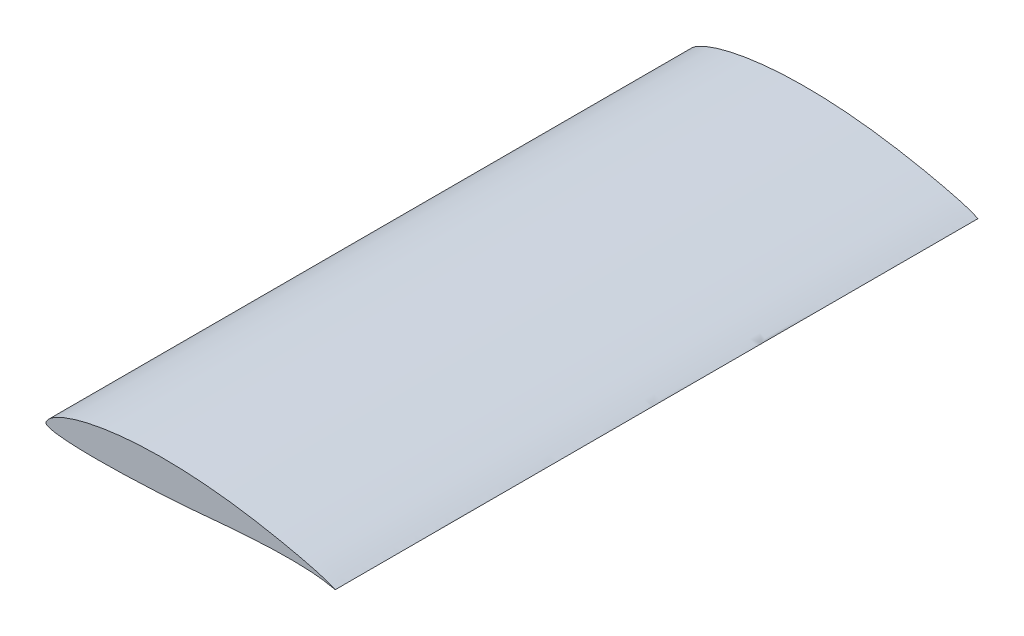
from build123d import *

# Parameters (mm, degrees)
BOSS_EXTRUDE1_DEPTH = 300


with BuildPart() as part:
    # Sketch1 → Boss-Extrude1 (new body)
    with BuildSketch(Plane.XY):
        with BuildLine():
            add(Edge.make_bspline(
                [(135, 0), (134.998856175, 0.011734331), (134.11877247, 0.333260919), (133.283583629, 0.733394832), (131.337782617, 1.50770618), (128.956602453, 2.286209997), (125.866023455, 3.16625559), (122.205613646, 4.118787736), (117.978812118, 5.136407228), (113.257079491, 6.194669425), (108.096676621, 7.270430983), (102.565667338, 8.338772342), (96.728352206, 9.3648848), (90.648870786, 10.316223784), (84.383887966, 11.155832684), (77.987641485, 11.853962041), (71.517637108, 12.402428106), (65.030841845, 12.79009708), (58.586715824, 13.000143501), (52.241828091, 13.028798077), (46.052187751, 12.876573765), (40.0697387, 12.537117596), (34.345018554, 12.019037133), (28.925444072, 11.334956535), (23.857171858, 10.506249331), (19.186584425, 9.54360867), (14.954211961, 8.477878883), (11.199486708, 7.322199999), (7.95395167, 6.10794757), (5.24216305, 4.860081916), (3.088507852, 3.610430378), (1.480582104, 2.370600711), (0.48831342, 1.213057815), (0.011852242, 0.395357712), (-0.008102004, -0.234860735), (0.400130368, -0.918035484), (1.746070552, -1.314768856), (3.653985826, -1.831338245), (6.328297823, -2.199558717), (9.659694307, -2.516444712), (13.645253431, -2.734899101), (18.231084992, -2.869337382), (23.370720618, -2.920002627), (29.005229526, -2.885079851), (35.071675286, -2.76841477), (41.503572026, -2.57040615), (48.231425582, -2.282953366), (55.186991831, -1.913504914), (62.308327518, -1.446499283), (69.549730117, -0.86817279), (76.867395967, -0.200406461), (84.204866877, 0.446142467), (91.466951805, 1.020717536), (98.53908503, 1.479607517), (105.302188706, 1.789518517), (111.633357938, 1.937188067), (117.420269605, 1.909305385), (122.523865845, 1.726646553), (126.889290121, 1.38143247), (130.220327227, 0.971114814), (132.890727166, 0.464937428), (133.96647544, 0.266874605), (135.001208219, -0.012394936), (135, 0)],
                knots=[0, 0, 0, 0, 0.001693524, 0.006395447, 0.013461651, 0.022753575, 0.034367307, 0.048191023, 0.064031392, 0.081680617, 0.100894124, 0.121431794, 0.143025453, 0.165434011, 0.188439039, 0.211855124, 0.235496289, 0.259143745, 0.282614908, 0.305701545, 0.328231584, 0.350030434, 0.370943883, 0.390816529, 0.409505873, 0.42685655, 0.442733385, 0.457018388, 0.46961507, 0.480449695, 0.48947186, 0.496730301, 0.502329147, 0.50625566, 0.506441945, 0.509181516, 0.513913846, 0.521178419, 0.530944157, 0.543144509, 0.557669674, 0.574383526, 0.593109554, 0.613638212, 0.635743557, 0.659184095, 0.683713689, 0.709075754, 0.735036066, 0.761429739, 0.788183766, 0.81505683, 0.841644764, 0.86751356, 0.892232409, 0.915363656, 0.936485325, 0.955199832, 0.971104187, 0.983751026, 0.992812818, 0.998211136, 1, 1, 1, 1], degree=3))
        make_face()
    extrude(amount=BOSS_EXTRUDE1_DEPTH)


solid = part.part
